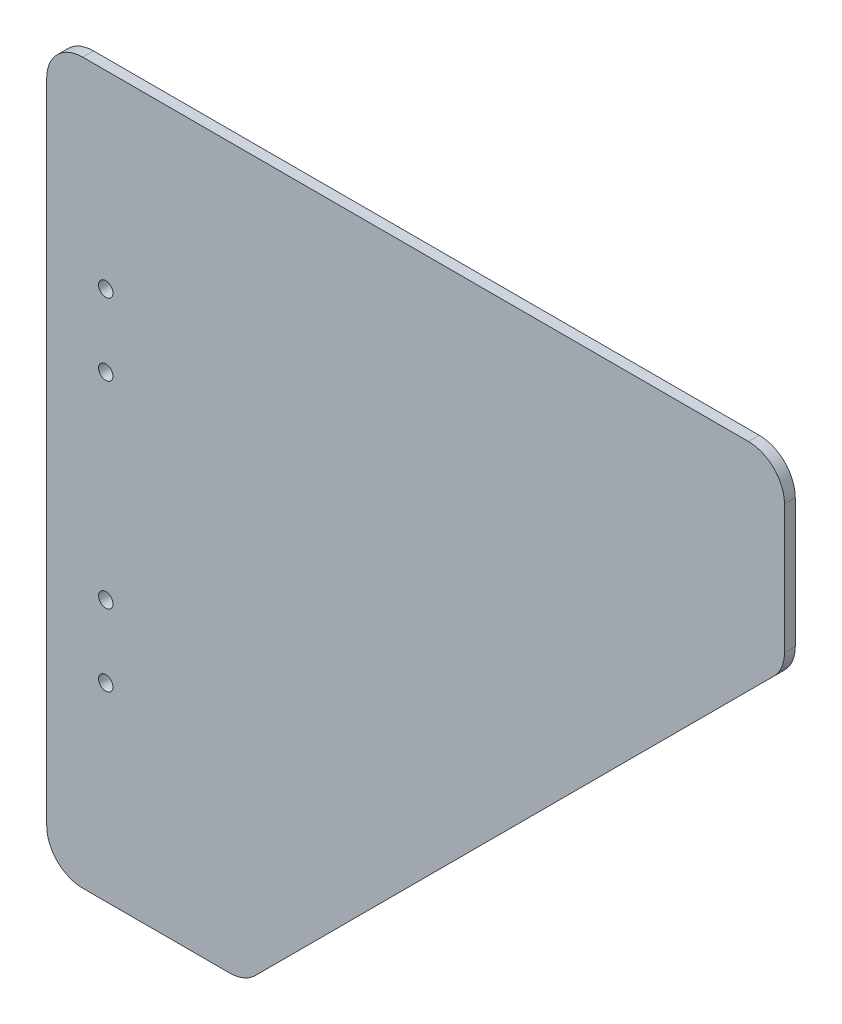
from build123d import *

# Parameters (mm, degrees)
ESTRUSIONE_ESTRUSIONE1_DEPTH = 3
SCHIZZO2_R                   = 2
TAGLIO_ESTRUSIONE1_DEPTH     = 10


with BuildPart() as part:
    # Schizzo1 → Estrusione-Estrusione1 (new body)
    with BuildSketch(Plane.XY):
        with BuildLine():
            Line((0, 10), (0, 190))
            ThreePointArc((0, 190), (2.928932188, 197.071067812), (10, 200))
            Line((10, 200), (195, 200))
            ThreePointArc((195, 200), (202.071067812, 197.071067812), (205, 190))
            Line((205, 190), (205, 154.142135624))
            ThreePointArc((205, 154.142135624), (204.238795325, 150.3153013), (202.071067812, 147.071067812))
            Line((202.071067812, 147.071067812), (57.928932188, 2.928932188))
            ThreePointArc((57.928932188, 2.928932188), (54.6846987, 0.761204675), (50.857864376, 0))
            Line((50.857864376, 0), (10, 0))
            ThreePointArc((10, 0), (2.928932188, 2.928932188), (0, 10))
        make_face()
    extrude(amount=ESTRUSIONE_ESTRUSIONE1_DEPTH)

    # Schizzo2 → Taglio-Estrusione1 (cut)
    with BuildSketch(Plane.XY.offset(3)):
        with Locations((16.4, 52.6)):
            Circle(SCHIZZO2_R)
        with Locations((16.4, 72.6)):
            Circle(SCHIZZO2_R)
        with Locations((16.4, 127.4)):
            Circle(SCHIZZO2_R)
        with Locations((16.4, 147.4)):
            Circle(SCHIZZO2_R)
    extrude(amount=-TAGLIO_ESTRUSIONE1_DEPTH, mode=Mode.SUBTRACT)


solid = part.part
